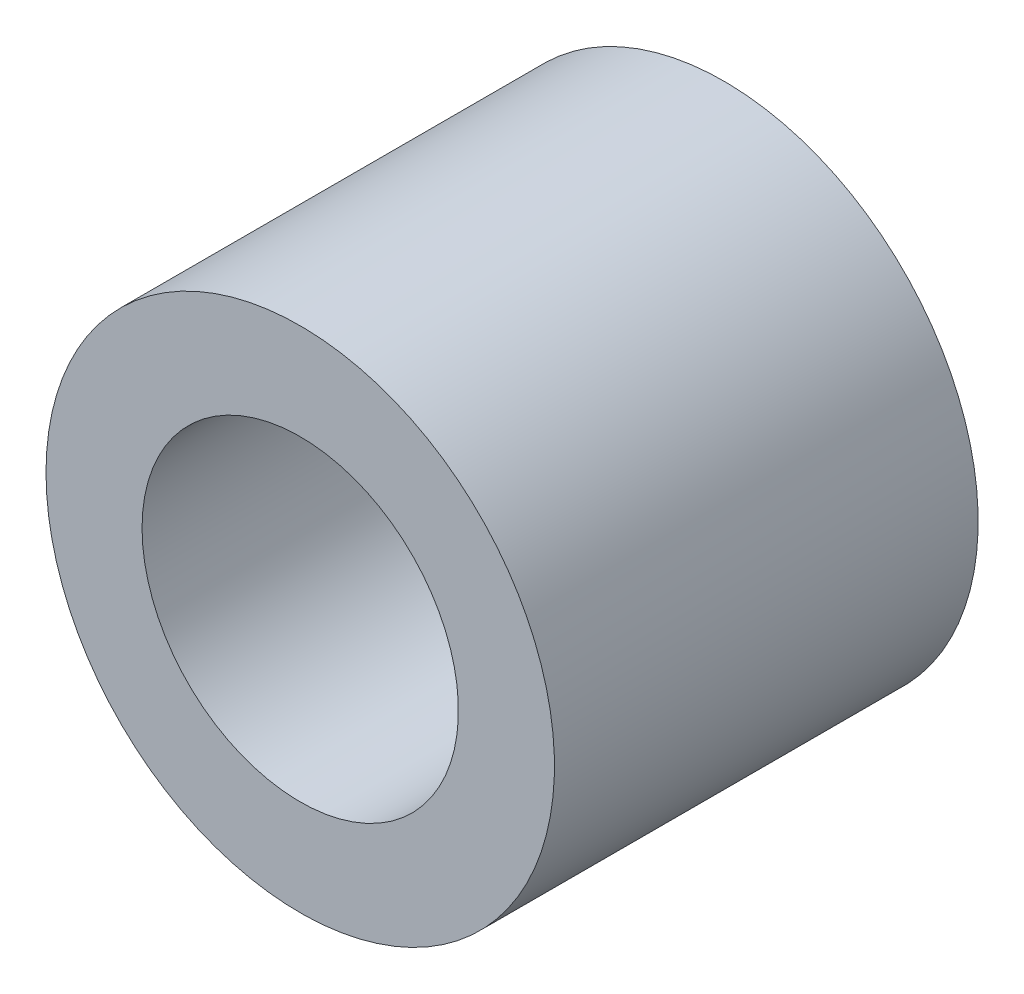
from build123d import *

# Parameters (mm, degrees)
SKETCH1_R           = 5.715
SKETCH1_R_2         = 3.556
BOSS_EXTRUDE1_DEPTH = 9.525


with BuildPart() as part:
    # Sketch1 → Boss-Extrude1 (new body)
    with BuildSketch(Plane.XY):
        Circle(SKETCH1_R)
        Circle(SKETCH1_R_2, mode=Mode.SUBTRACT)
    extrude(amount=BOSS_EXTRUDE1_DEPTH)


solid = part.part
